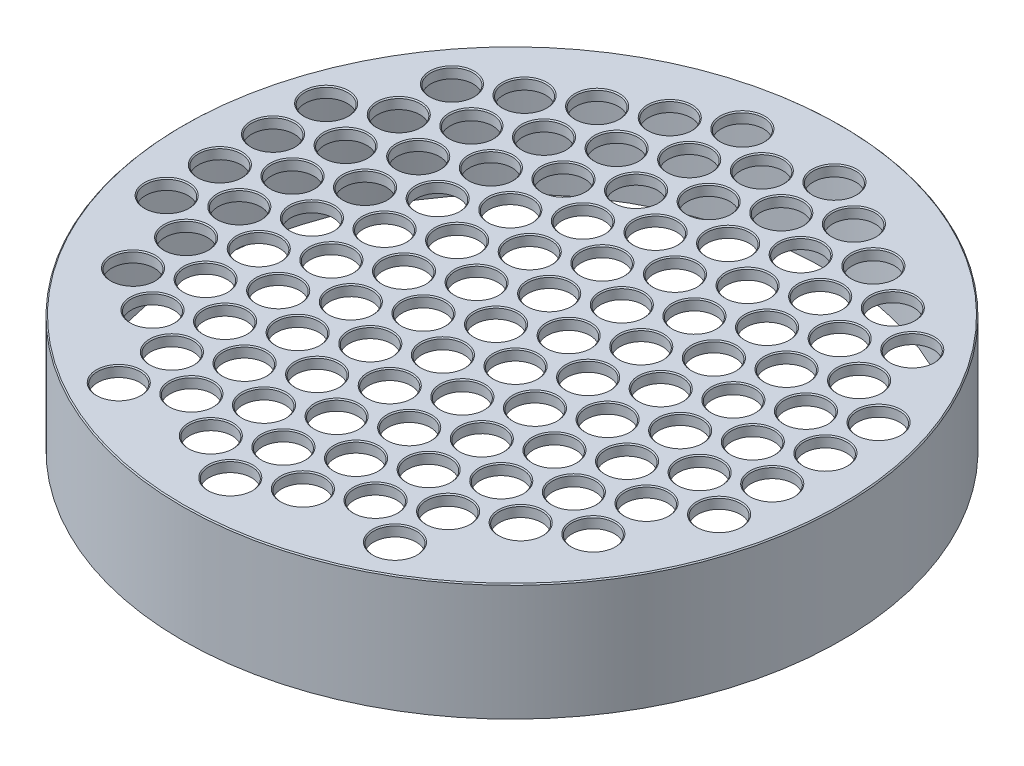
from build123d import *

# Parameters (mm, degrees)
SKETCH_1_R          = 62
SKETCH_1_R_2        = 59
EXTRUDE_1_DEPTH     = 20
SKETCH_2_R          = 62
EXTRUDE_2_DEPTH     = 2
SKETCH_3_R          = 4
CUT_EXTRUDE_1_DEPTH = 90.933308624
OTHER_START         = 20
OTHER_1_OUTLINE_R   = 4
OTHER_1_DEPTH       = 2
CHAMFER_1_SIZE      = 0.2


# Read off the part's stored shape, not the designer's step: 填充阵列1
with BuildPart() as part:
    # 草图1 → 凸台-拉伸1 (new body)
    with BuildSketch(Plane(origin=(0, 0, 0), x_dir=(1, 0, 0), z_dir=(0, 1, 0))):
        with Locations(Location((0, 0, 0), (0, 0, 270))):
            Circle(SKETCH_1_R)
        with Locations(Location((0, 0, 0), (0, 0, 270))):
            Circle(SKETCH_1_R_2, mode=Mode.SUBTRACT)
    extrude(amount=EXTRUDE_1_DEPTH)

    # 草图2 → 凸台-拉伸2 (add)
    with BuildSketch(Plane(origin=(0, 20, 0), x_dir=(1, 0, 0), z_dir=(0, 1, 0))):
        with Locations(Location((0, 0, 0), (0, 0, 270))):
            Circle(SKETCH_2_R)
    extrude(amount=EXTRUDE_2_DEPTH)

    # 草图3 → 切除-拉伸1 (cut, through all)
    with BuildSketch(Plane.XZ.offset(-20)):
        with Locations(Location((0, 53, 0), (0, 0, 270))):
            Circle(SKETCH_3_R)
    extrude(amount=-CUT_EXTRUDE_1_DEPTH, mode=Mode.SUBTRACT)

    # 填充阵列1 outline → 填充阵列1 (cut)
    with BuildSketch(Plane(origin=(0, 0, 0), x_dir=(1, 0, 0), z_dir=(0, 1, 0)).offset(OTHER_START)):
        with Locations((25.980762114, -48)):
            Circle(OTHER_1_OUTLINE_R)
        with Locations((8.660254038, 32)):
            Circle(OTHER_1_OUTLINE_R)
        with Locations((17.320508076, 37)):
            Circle(OTHER_1_OUTLINE_R)
        with Locations((25.980762114, 42)):
            Circle(OTHER_1_OUTLINE_R)
        with Locations((-51.961524227, 7)):
            Circle(OTHER_1_OUTLINE_R)
        with Locations((0, 27)):
            Circle(OTHER_1_OUTLINE_R)
        with Locations((-8.660254038, 22)):
            Circle(OTHER_1_OUTLINE_R)
        with Locations((-17.320508076, 17)):
            Circle(OTHER_1_OUTLINE_R)
        with Locations((-25.980762114, 12)):
            Circle(OTHER_1_OUTLINE_R)
        with Locations((-43.301270189, 12)):
            Circle(OTHER_1_OUTLINE_R)
        with Locations((-34.641016151, 17)):
            Circle(OTHER_1_OUTLINE_R)
        with Locations((-25.980762114, 22)):
            Circle(OTHER_1_OUTLINE_R)
        with Locations((-17.320508076, 27)):
            Circle(OTHER_1_OUTLINE_R)
        with Locations((-8.660254038, 32)):
            Circle(OTHER_1_OUTLINE_R)
        with Locations((0, 37)):
            Circle(OTHER_1_OUTLINE_R)
        with Locations((8.660254038, 42)):
            Circle(OTHER_1_OUTLINE_R)
        with Locations((17.320508076, 47)):
            Circle(OTHER_1_OUTLINE_R)
        with Locations((-8.660254038, 12)):
            Circle(OTHER_1_OUTLINE_R)
        with Locations((-17.320508076, 7)):
            Circle(OTHER_1_OUTLINE_R)
        with Locations((-25.980762114, 2)):
            Circle(OTHER_1_OUTLINE_R)
        with Locations((-34.641016151, -3)):
            Circle(OTHER_1_OUTLINE_R)
        with Locations((-43.301270189, -8)):
            Circle(OTHER_1_OUTLINE_R)
        with Locations((-51.961524227, -13)):
            Circle(OTHER_1_OUTLINE_R)
        with Locations((43.301270189, 32)):
            Circle(OTHER_1_OUTLINE_R)
        with Locations((34.641016151, 27)):
            Circle(OTHER_1_OUTLINE_R)
        with Locations((34.641016151, 37)):
            Circle(OTHER_1_OUTLINE_R)
        with Locations((-51.961524227, -3)):
            Circle(OTHER_1_OUTLINE_R)
        with Locations((-43.301270189, 2)):
            Circle(OTHER_1_OUTLINE_R)
        with Locations((-34.641016151, 7)):
            Circle(OTHER_1_OUTLINE_R)
        with Locations((25.980762114, 32)):
            Circle(OTHER_1_OUTLINE_R)
        with Locations((17.320508076, 27)):
            Circle(OTHER_1_OUTLINE_R)
        with Locations((8.660254038, 22)):
            Circle(OTHER_1_OUTLINE_R)
        with Locations((0, 17)):
            Circle(OTHER_1_OUTLINE_R)
        with Locations((-8.660254038, 52)):
            Circle(OTHER_1_OUTLINE_R)
        with Locations((-17.320508076, 47)):
            Circle(OTHER_1_OUTLINE_R)
        with Locations((-25.980762114, 42)):
            Circle(OTHER_1_OUTLINE_R)
        with Locations((-34.641016151, 37)):
            Circle(OTHER_1_OUTLINE_R)
        with Locations((-43.301270189, 32)):
            Circle(OTHER_1_OUTLINE_R)
        with Locations((8.660254038, 52)):
            Circle(OTHER_1_OUTLINE_R)
        with Locations((0, 47)):
            Circle(OTHER_1_OUTLINE_R)
        with Locations((-8.660254038, 42)):
            Circle(OTHER_1_OUTLINE_R)
        with Locations((-17.320508076, 37)):
            Circle(OTHER_1_OUTLINE_R)
        with Locations((-25.980762114, 32)):
            Circle(OTHER_1_OUTLINE_R)
        with Locations((-34.641016151, 27)):
            Circle(OTHER_1_OUTLINE_R)
        with Locations((-43.301270189, 22)):
            Circle(OTHER_1_OUTLINE_R)
        with Locations((-51.961524227, 17)):
            Circle(OTHER_1_OUTLINE_R)
        with Locations((34.641016151, -13)):
            Circle(OTHER_1_OUTLINE_R)
        with Locations((43.301270189, -8)):
            Circle(OTHER_1_OUTLINE_R)
        with Locations((51.961524227, -3)):
            Circle(OTHER_1_OUTLINE_R)
        with Locations((-25.980762114, -38)):
            Circle(OTHER_1_OUTLINE_R)
        with Locations((25.980762114, -18)):
            Circle(OTHER_1_OUTLINE_R)
        with Locations((17.320508076, -23)):
            Circle(OTHER_1_OUTLINE_R)
        with Locations((8.660254038, -28)):
            Circle(OTHER_1_OUTLINE_R)
        with Locations((0, -33)):
            Circle(OTHER_1_OUTLINE_R)
        with Locations((-17.320508076, -33)):
            Circle(OTHER_1_OUTLINE_R)
        with Locations((-8.660254038, -28)):
            Circle(OTHER_1_OUTLINE_R)
        with Locations((0, -23)):
            Circle(OTHER_1_OUTLINE_R)
        with Locations((8.660254038, -18)):
            Circle(OTHER_1_OUTLINE_R)
        with Locations((17.320508076, -13)):
            Circle(OTHER_1_OUTLINE_R)
        with Locations((25.980762114, -8)):
            Circle(OTHER_1_OUTLINE_R)
        with Locations((34.641016151, -3)):
            Circle(OTHER_1_OUTLINE_R)
        with Locations((43.301270189, 2)):
            Circle(OTHER_1_OUTLINE_R)
        with Locations((43.301270189, -28)):
            Circle(OTHER_1_OUTLINE_R)
        with Locations((-8.660254038, -48)):
            Circle(OTHER_1_OUTLINE_R)
        with Locations((0, -43)):
            Circle(OTHER_1_OUTLINE_R)
        with Locations((8.660254038, -38)):
            Circle(OTHER_1_OUTLINE_R)
        with Locations((34.641016151, -33)):
            Circle(OTHER_1_OUTLINE_R)
        with Locations((25.980762114, -38)):
            Circle(OTHER_1_OUTLINE_R)
        with Locations((17.320508076, -43)):
            Circle(OTHER_1_OUTLINE_R)
        with Locations((8.660254038, -48)):
            Circle(OTHER_1_OUTLINE_R)
        with Locations((51.961524227, -13)):
            Circle(OTHER_1_OUTLINE_R)
        with Locations((-25.980762114, -48)):
            Circle(OTHER_1_OUTLINE_R)
        with Locations((-17.320508076, -43)):
            Circle(OTHER_1_OUTLINE_R)
        with Locations((-8.660254038, -38)):
            Circle(OTHER_1_OUTLINE_R)
        with Locations((43.301270189, -18)):
            Circle(OTHER_1_OUTLINE_R)
        with Locations((34.641016151, -23)):
            Circle(OTHER_1_OUTLINE_R)
        with Locations((25.980762114, -28)):
            Circle(OTHER_1_OUTLINE_R)
        with Locations((17.320508076, -33)):
            Circle(OTHER_1_OUTLINE_R)
        with Locations((25.980762114, 12)):
            Circle(OTHER_1_OUTLINE_R)
        with Locations((34.641016151, 17)):
            Circle(OTHER_1_OUTLINE_R)
        with Locations((43.301270189, 22)):
            Circle(OTHER_1_OUTLINE_R)
        with Locations((-43.301270189, -18)):
            Circle(OTHER_1_OUTLINE_R)
        with Locations((17.320508076, 7)):
            Circle(OTHER_1_OUTLINE_R)
        with Locations((8.660254038, 2)):
            Circle(OTHER_1_OUTLINE_R)
        with Locations((0, -3)):
            Circle(OTHER_1_OUTLINE_R)
        with Locations((-8.660254038, -8)):
            Circle(OTHER_1_OUTLINE_R)
        with Locations((-34.641016151, -13)):
            Circle(OTHER_1_OUTLINE_R)
        with Locations((-25.980762114, -8)):
            Circle(OTHER_1_OUTLINE_R)
        with Locations((-17.320508076, -3)):
            Circle(OTHER_1_OUTLINE_R)
        with Locations((-8.660254038, 2)):
            Circle(OTHER_1_OUTLINE_R)
        with Locations((0, 7)):
            Circle(OTHER_1_OUTLINE_R)
        with Locations((8.660254038, 12)):
            Circle(OTHER_1_OUTLINE_R)
        with Locations((17.320508076, 17)):
            Circle(OTHER_1_OUTLINE_R)
        with Locations((25.980762114, 22)):
            Circle(OTHER_1_OUTLINE_R)
        with Locations((17.320508076, -3)):
            Circle(OTHER_1_OUTLINE_R)
        with Locations((8.660254038, -8)):
            Circle(OTHER_1_OUTLINE_R)
        with Locations((0, -13)):
            Circle(OTHER_1_OUTLINE_R)
        with Locations((-8.660254038, -18)):
            Circle(OTHER_1_OUTLINE_R)
        with Locations((51.961524227, 7)):
            Circle(OTHER_1_OUTLINE_R)
        with Locations((-34.641016151, -33)):
            Circle(OTHER_1_OUTLINE_R)
        with Locations((-25.980762114, -28)):
            Circle(OTHER_1_OUTLINE_R)
        with Locations((-17.320508076, -23)):
            Circle(OTHER_1_OUTLINE_R)
        with Locations((25.980762114, 2)):
            Circle(OTHER_1_OUTLINE_R)
        with Locations((34.641016151, 7)):
            Circle(OTHER_1_OUTLINE_R)
        with Locations((43.301270189, 12)):
            Circle(OTHER_1_OUTLINE_R)
        with Locations((51.961524227, 17)):
            Circle(OTHER_1_OUTLINE_R)
        with Locations((-43.301270189, -28)):
            Circle(OTHER_1_OUTLINE_R)
        with Locations((-34.641016151, -23)):
            Circle(OTHER_1_OUTLINE_R)
        with Locations((-25.980762114, -18)):
            Circle(OTHER_1_OUTLINE_R)
        with Locations((-17.320508076, -13)):
            Circle(OTHER_1_OUTLINE_R)
    extrude(amount=OTHER_1_DEPTH, mode=Mode.SUBTRACT)

    # 倒角1
    chamfer_1_edges = [part.edges().sort_by_distance(p)[0] for p in [
        (0, 22, -62),
        (-21.320508076, 22, 13),
        (-29.980762114, 22, 18),
        (-38.641016151, 22, 23),
        (0, 22, 57),
        (-47.301270189, 22, 28),
        (47.961524227, 22, -17),
        (39.301270189, 22, -12),
        (30.641016151, 22, -7),
        (21.980762114, 22, -2),
        (-21.320508076, 22, 23),
        (-29.980762114, 22, 28),
        (-38.641016151, 22, 33),
        (47.961524227, 22, -7),
        (-12.660254038, 22, 18),
        (-4, 22, 13),
        (4.660254038, 22, 8),
        (13.320508076, 22, 3),
        (21.980762114, 22, -22),
        (13.320508076, 22, -17),
        (4.660254038, 22, -12),
        (-4, 22, -7),
        (-12.660254038, 22, -2),
        (-21.320508076, 22, 3),
        (-29.980762114, 22, 8),
        (-38.641016151, 22, 13),
        (-12.660254038, 22, 8),
        (-4, 22, 3),
        (4.660254038, 22, -2),
        (13.320508076, 22, -7),
        (-47.301270189, 22, 18),
        (39.301270189, 22, -22),
        (30.641016151, 22, -17),
        (21.980762114, 22, -12),
        (13.320508076, 22, 33),
        (21.980762114, 22, 28),
        (30.641016151, 22, 23),
        (39.301270189, 22, 18),
        (-12.660254038, 22, 38),
        (-21.320508076, 22, 43),
        (-29.980762114, 22, 48),
        (47.961524227, 22, 13),
        (4.660254038, 22, 48),
        (13.320508076, 22, 43),
        (21.980762114, 22, 38),
        (30.641016151, 22, 33),
        (4.660254038, 22, 38),
        (-4, 22, 43),
        (-12.660254038, 22, 48),
        (39.301270189, 22, 28),
        (39.301270189, 22, -2),
        (30.641016151, 22, 3),
        (21.980762114, 22, 8),
        (13.320508076, 22, 13),
        (4.660254038, 22, 18),
        (-4, 22, 23),
        (-12.660254038, 22, 28),
        (-21.320508076, 22, 33),
        (-4, 22, 33),
        (4.660254038, 22, 28),
        (13.320508076, 22, 23),
        (21.980762114, 22, 18),
        (-29.980762114, 22, 38),
        (47.961524227, 22, 3),
        (39.301270189, 22, 8),
        (30.641016151, 22, 13),
        (-55.961524227, 22, -17),
        (-47.301270189, 22, -22),
        (-38.641016151, 22, -27),
        (-29.980762114, 22, -32),
        (-21.320508076, 22, -37),
        (-12.660254038, 22, -42),
        (-4, 22, -47),
        (4.660254038, 22, -52),
        (-47.301270189, 22, -32),
        (-38.641016151, 22, -37),
        (-29.980762114, 22, -42),
        (-21.320508076, 22, -47),
        (-12.660254038, 22, -52),
        (-4, 22, -17),
        (4.660254038, 22, -22),
        (13.320508076, 22, -27),
        (21.980762114, 22, -32),
        (-38.641016151, 22, -7),
        (-47.301270189, 22, -2),
        (-55.961524227, 22, 3),
        (30.641016151, 22, -37),
        (30.641016151, 22, -27),
        (39.301270189, 22, -32),
        (-55.961524227, 22, 13),
        (-47.301270189, 22, 8),
        (-38.641016151, 22, 3),
        (-29.980762114, 22, -2),
        (-21.320508076, 22, -7),
        (-12.660254038, 22, -12),
        (13.320508076, 22, -47),
        (4.660254038, 22, -42),
        (-4, 22, -37),
        (-12.660254038, 22, -32),
        (-21.320508076, 22, -27),
        (-29.980762114, 22, -22),
        (-38.641016151, 22, -17),
        (-47.301270189, 22, -12),
        (-29.980762114, 22, -12),
        (-21.320508076, 22, -17),
        (-12.660254038, 22, -22),
        (-4, 22, -27),
        (-55.961524227, 22, -7),
        (21.980762114, 22, -42),
        (13.320508076, 22, -37),
        (4.660254038, 22, -32),
        (21.980762114, 22, 48),
    ]]
    chamfer(chamfer_1_edges, length=CHAMFER_1_SIZE)


solid = part.part
